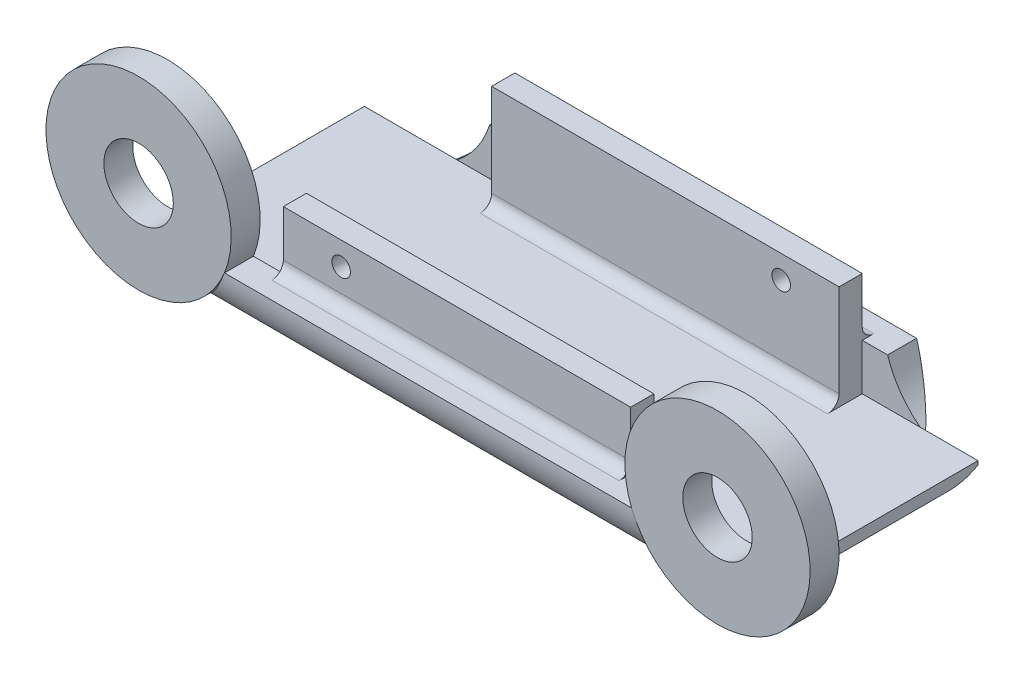
from build123d import *
from build123d.topology import SkipClean

# Parameters (mm, degrees)
SKETCH_1_W               = 50
SKETCH_1_H               = 25
EXTRUDE_1_DEPTH          = 10
CUT_EXTRUDE_1_REACH      = 54.5
SKETCH_3_W               = 16
SKETCH_3_H               = 9
CUT_EXTRUDE_2_DEPTH      = 53.5
SKETCH_14_W              = 50
SKETCH_14_H              = 5
CUT_EXTRUDE_5_DEPTH      = 2.5
SKETCH_15_W              = 50
SKETCH_15_H              = 5
CUT_EXTRUDE_6_DEPTH      = 2.5
HOLE_WIZARD_M2_1_D       = 1.6
HOLE_WIZARD_M2_1_DEPTH   = 2
HOLE_WIZARD_M2_2_D       = 1.6
HOLE_WIZARD_M2_2_DEPTH   = 2
SKETCH_19_W              = 10
SKETCH_19_H              = 9
CUT_EXTRUDE_10_DEPTH     = 2
SKETCH_21_R              = 8
EXTRUDE_5_DEPTH          = 2.5
SKETCH_22_W              = 10
SKETCH_22_H              = 9
CUT_EXTRUDE_12_DEPTH     = 2
CUT_EXTRUDE_START        = -2.5
CUT_EXTRUDE_13_OUTLINE_R = 3
CUT_EXTRUDE_13_DEPTH     = 2.5
SKETCH_17_R              = 8.2
CUT_EXTRUDE_15_DEPTH     = 10
EXTRUDE_6_DEPTH          = 3
FILLET_1_R               = 1
FILLET_2_R               = 1


# Read off the part's stored shape, not the designer's step: 切除-拉伸13
with BuildPart() as part:
    # 草图1 → 凸台-拉伸1 (new body)
    with BuildSketch(Plane(origin=(0, 0, 0), x_dir=(1, 0, 0), z_dir=(0, 1, 0))):
        Rectangle(SKETCH_1_W, SKETCH_1_H)
    extrude(amount=EXTRUDE_1_DEPTH)

    # 草图2 → 切除-拉伸1 (cut, up to next)
    with BuildSketch(Plane(origin=(25, 0, 0), x_dir=(0, 0, -1), z_dir=(1, 0, 0)), mode=Mode.PRIVATE) as cut_extrude_1_sk1:
        with BuildLine():
            Line((-12.5, 0), (-7.5, 0))
            ThreePointArc((-7.5, 0), (-11.035533906, 1.464466094), (-12.5, 5))
            Line((-12.5, 5), (-12.5, 0))
        make_face()
    cut_extrude_1_tool1 = extrude(cut_extrude_1_sk1.sketch, amount=-CUT_EXTRUDE_1_REACH, mode=Mode.PRIVATE) & part.part
    # 草图2 → 切除-拉伸1 (cut, up to next)
    with BuildSketch(Plane(origin=(25, 0, 0), x_dir=(0, 0, -1), z_dir=(1, 0, 0)), mode=Mode.PRIVATE) as cut_extrude_1_sk2:
        with BuildLine():
            Line((12.5, 5), (12.5, 0))
            Line((12.5, 0), (7.5, 0))
            ThreePointArc((7.5, 0), (11.035533906, 1.464466094), (12.5, 5))
        make_face()
    cut_extrude_1_tool2 = extrude(cut_extrude_1_sk2.sketch, amount=-CUT_EXTRUDE_1_REACH, mode=Mode.PRIVATE) & part.part
    add(cut_extrude_1_tool1.solids().sort_by_distance((25, 1.11684, 11.38316))[0], mode=Mode.SUBTRACT)
    add(cut_extrude_1_tool2.solids().sort_by_distance((25, 1.11684, -11.38316))[0], mode=Mode.SUBTRACT)

    # 草图3 → 切除-拉伸2 (cut, through all)
    with BuildSketch(Plane(origin=(25, 0, 0), x_dir=(0, 0, -1), z_dir=(1, 0, 0))):
        with Locations((0, 5.5)):
            Rectangle(SKETCH_3_W, SKETCH_3_H)
    extrude(amount=-CUT_EXTRUDE_2_DEPTH, mode=Mode.SUBTRACT)

    # 草图14 → 切除-拉伸5 (cut)
    with BuildSketch(Plane(origin=(0, 0, -12.5), x_dir=(-1, 0, 0), z_dir=(0, 0, -1))):
        with Locations((0, 7.5)):
            Rectangle(SKETCH_14_W, SKETCH_14_H)
    extrude(amount=-CUT_EXTRUDE_5_DEPTH, mode=Mode.SUBTRACT)

    # 草图15 → 切除-拉伸6 (cut)
    with BuildSketch(Plane.XY.offset(12.5)):
        with Locations((0, 7.5)):
            Rectangle(SKETCH_15_W, SKETCH_15_H)
    extrude(amount=-CUT_EXTRUDE_6_DEPTH, mode=Mode.SUBTRACT)

    # M2 螺纹孔1
    with Locations(Plane(origin=(0, 0, -10), x_dir=(-1, 0, 0), z_dir=(0, 0, -1))):
        with Locations((-10, 8)):
            Hole(HOLE_WIZARD_M2_1_D / 2, depth=HOLE_WIZARD_M2_1_DEPTH)

    # M2 螺纹孔2
    with Locations(Plane.XY.offset(10)):
        with Locations((-10, 8)):
            Hole(HOLE_WIZARD_M2_2_D / 2, depth=HOLE_WIZARD_M2_2_DEPTH)

    # 草图19 → 切除-拉伸10 (cut)
    with BuildSketch(Plane.XY.offset(-8)):
        with Locations((-20, 5.5)):
            Rectangle(SKETCH_19_W, SKETCH_19_H)
        with Locations((20, 5.5)):
            Rectangle(SKETCH_19_W, SKETCH_19_H)
    extrude(amount=-CUT_EXTRUDE_10_DEPTH, mode=Mode.SUBTRACT)

    # 草图21 → 凸台-拉伸5 (add)
    with SkipClean():  # the faces are left unmerged after this step: merging them gives an invalid solid
        with BuildSketch(Plane.XY.offset(10)):
            with Locations((25, 8)):
                Circle(SKETCH_21_R)
            with Locations((-25, 8)):
                Circle(SKETCH_21_R)
        extrude(amount=EXTRUDE_5_DEPTH)

    # 草图22 → 切除-拉伸12 (cut)
    with SkipClean():  # the faces are left unmerged after this step: merging them gives an invalid solid
        with BuildSketch(Plane.XY.offset(10)):
            with Locations((-20, 5.5)):
                Rectangle(SKETCH_22_W, SKETCH_22_H)
            with Locations((20, 5.5)):
                Rectangle(SKETCH_22_W, SKETCH_22_H)
        extrude(amount=-CUT_EXTRUDE_12_DEPTH, mode=Mode.SUBTRACT)

    # 切除-拉伸13 outline → 切除-拉伸13 (cut)
    with SkipClean():  # the faces are left unmerged after this step: merging them gives an invalid solid
        with BuildSketch(Plane.XY.offset(12.5).offset(CUT_EXTRUDE_START)):
            with Locations((25, 8)):
                Circle(CUT_EXTRUDE_13_OUTLINE_R)
            with Locations((-25, 8)):
                Circle(CUT_EXTRUDE_13_OUTLINE_R)
        extrude(amount=CUT_EXTRUDE_13_DEPTH, mode=Mode.SUBTRACT)

    # 草图17 → 切除-拉伸15 (cut)
    with SkipClean():  # the faces are left unmerged after this step: merging them gives an invalid solid
        with BuildSketch(Plane(origin=(0, 0, -10), x_dir=(-1, 0, 0), z_dir=(0, 0, -1))):
            with Locations((-25, 7.5)):
                Circle(SKETCH_17_R)
            with Locations((25, 7.5)):
                Circle(SKETCH_17_R)
        extrude(amount=CUT_EXTRUDE_15_DEPTH, mode=Mode.SUBTRACT)

    # 草图24 → 凸台-拉伸6 (add)
    with SkipClean():  # the faces are left unmerged after this step: merging them gives an invalid solid
        with BuildSketch(Plane.ZY.offset(25)):
            with BuildLine():
                Line((10, 1), (-10, 1))
                Line((-10, 1), (-10, 0.669872981))
                ThreePointArc((-10, 0.669872981), (-8.794095226, 0.170370869), (-7.5, 0))
                Line((-7.5, 0), (7.5, 0))
                ThreePointArc((7.5, 0), (8.794095226, 0.170370869), (10, 0.669872981))
                Line((10, 0.669872981), (10, 1))
            make_face()
        extrude(amount=EXTRUDE_6_DEPTH)

    # 圆角1
    # the kernel refuses this fillet: 1 mm, written as the material it adds along each edge
    with BuildSketch(Plane(origin=(15, 1, 8), x_dir=(0, 0, -1), z_dir=(-1, 0, 0))) as fillet_1_piece_1:
        with BuildLine():
            CenterArc((FILLET_1_R, -FILLET_1_R), FILLET_1_R, 90, 90)
            Line((0, -FILLET_1_R), (0, 0))
            Line((0, 0), (FILLET_1_R, 0))
        make_face()
    extrude(amount=30)
    with BuildSketch(Plane(origin=(15, 1, -8), x_dir=(0, 0, 1), z_dir=(-1, 0, 0))) as fillet_1_piece_2:
        with BuildLine():
            CenterArc((FILLET_1_R, FILLET_1_R), FILLET_1_R, 180, 90)
            Line((0, FILLET_1_R), (0, 0))
            Line((0, 0), (FILLET_1_R, 0))
        make_face()
    extrude(amount=30)

    # 圆角2
    fillet_2_edges = [part.edges().sort_by_distance(p)[0] for p in [
        (0, 5, -10),
        (0, 5, 10),
    ]]
    fillet(fillet_2_edges, radius=FILLET_2_R)


solid = part.part
